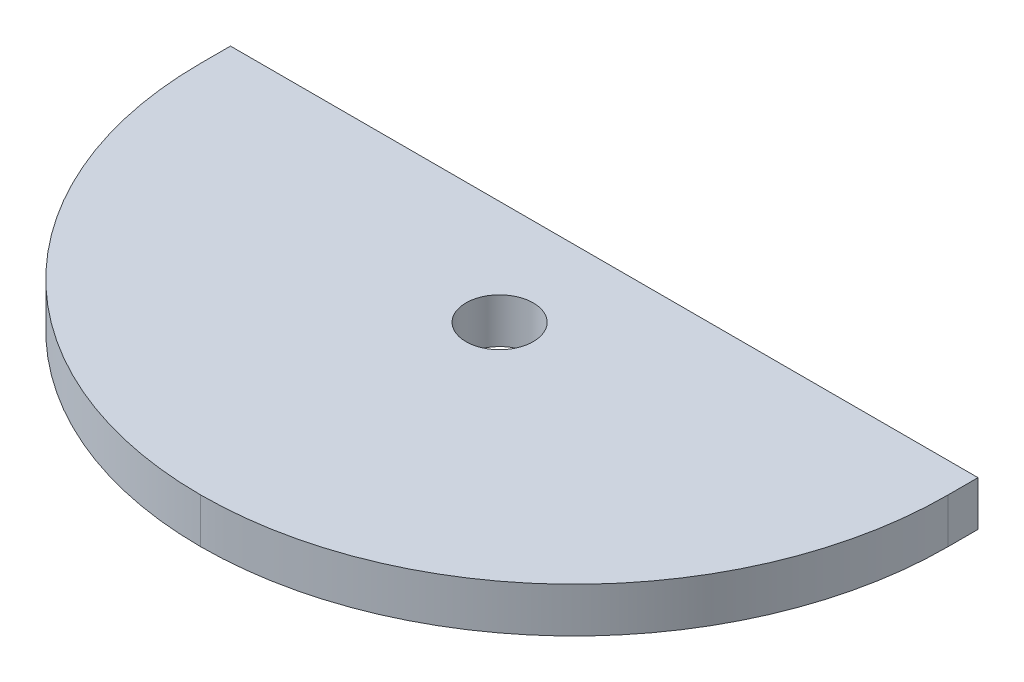
from build123d import *

# Parameters (mm, degrees)
SKETCH1_W                = 50
SKETCH1_H                = 27
BOSS_EXTRUDE1_DEPTH      = 3
FILLET1_R                = 25
M4_CLEARANCE_HOLE2_D     = 4.5
M4_CLEARANCE_HOLE2_DEPTH = 3
M4_CLEARANCE_HOLE2_TIP   = 1.351936393


with BuildPart() as part:
    # Sketch1 → Boss-Extrude1 (new body)
    with BuildSketch(Plane(origin=(0, 0, 0), x_dir=(1, 0, 0), z_dir=(0, 1, 0))):
        with Locations((25, 13.5)):
            Rectangle(SKETCH1_W, SKETCH1_H)
    extrude(amount=BOSS_EXTRUDE1_DEPTH)

    # Fillet1
    fillet1_edges = [part.edges().sort_by_distance(p)[0] for p in [
        (50, 1.5, 0),
        (0, 1.5, 0),
    ]]
    fillet(fillet1_edges, radius=FILLET1_R - 0.0001)  # a hair under: the kernel refuses the full size

    # M4 Clearance Hole2
    with Locations(Plane(origin=(0, 3, 0), x_dir=(1, 0, 0), z_dir=(0, 1, 0))):
        with Locations((25, 20)):
            Hole(M4_CLEARANCE_HOLE2_D / 2, depth=M4_CLEARANCE_HOLE2_DEPTH)
            with Locations((0, 0, -(M4_CLEARANCE_HOLE2_DEPTH + M4_CLEARANCE_HOLE2_TIP / 2))):  # 118° drill point
                Cone(0, M4_CLEARANCE_HOLE2_D / 2, M4_CLEARANCE_HOLE2_TIP, mode=Mode.SUBTRACT)


solid = part.part
